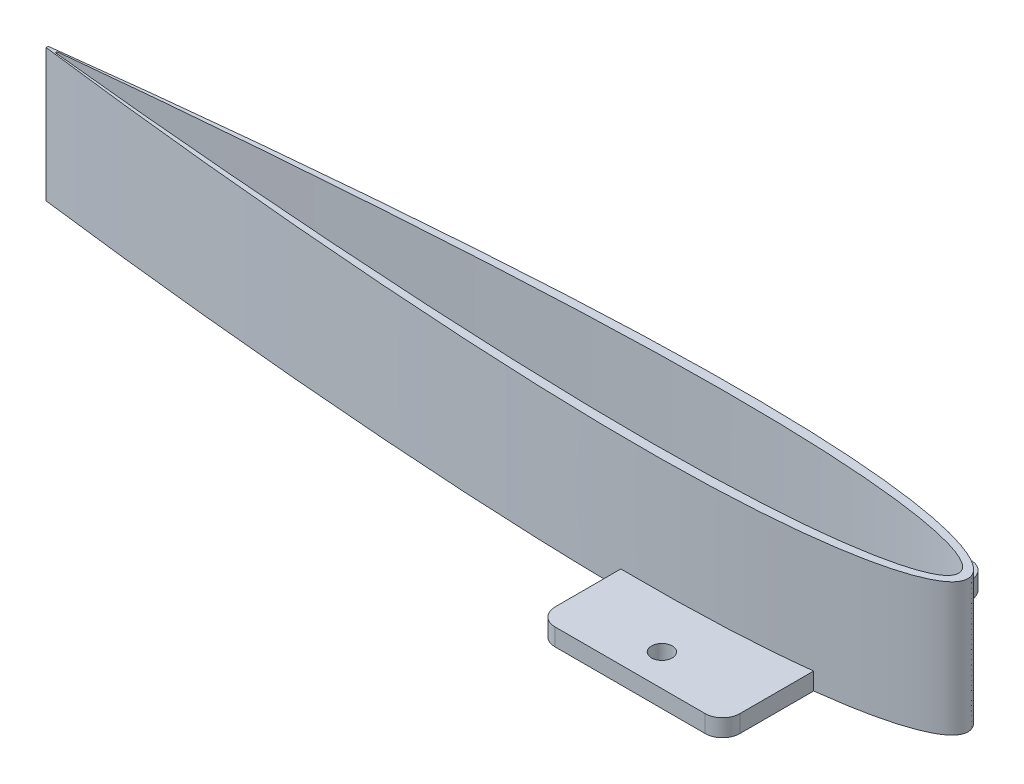
from build123d import *

# Parameters (mm, degrees)
BOSS_EXTRUDE1_DEPTH = 23
BOSS_EXTRUDE2_DEPTH = 3
CUT_EXTRUDE1_DEPTH  = 20
SKETCH4_R           = 1.8
CUT_EXTRUDE2_DEPTH  = 3


with BuildPart() as part:
    # Sketch1 → Boss-Extrude1 (new body)
    with BuildSketch(Plane(origin=(0, 0, 0), x_dir=(1, 0, 0), z_dir=(0, 1, 0))):
        with BuildLine():
            Line((-157.869, 0.181274205), (-157.869, -0.181274205))
            add(Edge.make_bspline(
                [(-157.869, 0.181274205), (-157.723403485, 0.199684926), (-157.142658378, 0.27312031), (-155.841955062, 0.436336132), (-153.689949438, 0.702894529), (-150.710182134, 1.064767751), (-146.935282047, 1.511699058), (-142.406585427, 2.031589686), (-137.173699622, 2.611192499), (-131.293955997, 3.236548664), (-124.831782054, 3.893294181), (-117.857991102, 4.566742449), (-110.449000996, 5.241792153), (-102.685990365, 5.902721731), (-94.654002783, 6.53297403), (-86.441009657, 7.115044129), (-78.136943231, 7.630574259), (-69.832711318, 8.060727481), (-61.619204695, 8.386862904), (-53.586307274, 8.591476899), (-45.821915366, 8.659319048), (-38.410975522, 8.578542481), (-31.434526786, 8.341736926), (-24.9687979, 7.946648949), (-19.084163696, 7.396579475), (-13.844510096, 6.699995358), (-9.304988726, 5.870590418), (-5.513605552, 4.923957812), (-2.498226595, 3.881769527), (-0.284248225, 2.747909514), (1.187201791, 1.521072632), (1.779058139, 0), (1.187201791, -1.521072632), (-0.284248225, -2.747909514), (-2.498226595, -3.881769527), (-5.513605552, -4.923957812), (-9.304988726, -5.870590418), (-13.844510096, -6.699995358), (-19.084163696, -7.396579475), (-24.9687979, -7.946648949), (-31.434526786, -8.341736926), (-38.410975522, -8.578542481), (-45.821915366, -8.659319048), (-53.586307274, -8.591476899), (-61.619204695, -8.386862904), (-69.832711318, -8.060727481), (-78.136943231, -7.630574259), (-86.441009657, -7.115044129), (-94.654002783, -6.53297403), (-102.685990365, -5.902721731), (-110.449000996, -5.241792153), (-117.857991102, -4.566742449), (-124.831782054, -3.893294181), (-131.293955997, -3.236548664), (-137.173699622, -2.611192499), (-142.406585427, -2.031589686), (-146.935282047, -1.511699058), (-150.710182134, -1.064767751), (-153.689949438, -0.702894529), (-155.841955062, -0.436336132), (-157.142658378, -0.27312031), (-157.723403485, -0.199684926), (-157.869, -0.181274205)],
                knots=[0, 0, 0, 0, 0.001358256, 0.005417715, 0.012132677, 0.021427702, 0.033198659, 0.047314098, 0.063616896, 0.081926116, 0.102039059, 0.123733469, 0.146769932, 0.170894438, 0.195841172, 0.221335499, 0.247097189, 0.272843817, 0.298294319, 0.323172601, 0.347211094, 0.370154165, 0.39176129, 0.41181002, 0.43009888, 0.446450615, 0.460716618, 0.472784432, 0.482593054, 0.490169979, 0.495736064, 0.5, 0.504263936, 0.509830021, 0.517406946, 0.527215568, 0.539283382, 0.553549385, 0.56990112, 0.58818998, 0.60823871, 0.629845835, 0.652788906, 0.676827399, 0.701705681, 0.727156183, 0.752902811, 0.778664501, 0.804158828, 0.829105562, 0.853230068, 0.876266531, 0.897960941, 0.918073884, 0.936383104, 0.952685902, 0.966801341, 0.978572298, 0.987867323, 0.994582285, 0.998641744, 1, 1, 1, 1], degree=3))
        make_face()
    extrude(amount=BOSS_EXTRUDE1_DEPTH)

    # Sketch2 → Boss-Extrude2 (add)
    with BuildSketch(Plane(origin=(0, 0, 0), x_dir=(1, 0, 0), z_dir=(0, 1, 0))):
        with BuildLine():
            Line((-46.9, -23), (-20.9, -23))
            ThreePointArc((-20.9, -23), (-18.778679656, -22.121320344), (-17.9, -20))
            Line((-17.9, -20), (-17.9, 20))
            ThreePointArc((-17.9, 20), (-18.778679656, 22.121320344), (-20.9, 23))
            Line((-20.9, 23), (-46.9, 23))
            ThreePointArc((-46.9, 23), (-49.021320344, 22.121320344), (-49.9, 20))
            Line((-49.9, 20), (-49.9, -20))
            ThreePointArc((-49.9, -20), (-49.021320344, -22.121320344), (-46.9, -23))
        make_face()
    extrude(amount=BOSS_EXTRUDE2_DEPTH)

    # Sketch3 → Cut-Extrude1 (cut)
    with BuildSketch(Plane(origin=(0, 23, 0), x_dir=(1, 0, 0), z_dir=(0, 1, 0))):
        with BuildLine():
            Line((-156.269, 0.147674205), (-156.269, -0.147674205))
            add(Edge.make_bspline(
                [(-156.269, 0.147674205), (-156.126324674, 0.162672461), (-155.557217694, 0.222497885), (-154.282577703, 0.355464773), (-152.173695683, 0.572621383), (-149.25365164, 0.867426534), (-145.554425881, 1.231523862), (-141.116532681, 1.65505633), (-135.988587734, 2.127231855), (-130.226773052, 2.63667887), (-123.894221597, 3.171696002), (-117.06032254, 3.720319142), (-109.799957344, 4.270246241), (-102.192674917, 4.808669712), (-94.321815716, 5.322100923), (-86.273595032, 5.796278851), (-78.136156293, 6.216247622), (-69.998605412, 6.566661356), (-61.950036814, 6.832334985), (-54.07856146, 6.999011569), (-46.470343565, 7.05427352), (-39.208658653, 6.988476831), (-32.372955807, 6.795608395), (-26.037997474, 6.473828853), (-20.272823955, 6.025963621), (-15.1403125, 5.458700103), (-10.69468594, 4.784299696), (-6.984476002, 4.013262029), (-4.036844712, 3.172086609), (-1.883328121, 2.24853683), (-0.448695997, 1.294392807), (0.1855032, 0), (-0.448695997, -1.294392807), (-1.883328121, -2.24853683), (-4.036844712, -3.172086609), (-6.984476002, -4.013262029), (-10.69468594, -4.784299696), (-15.1403125, -5.458700103), (-20.272823955, -6.025963621), (-26.037997474, -6.473828853), (-32.372955807, -6.795608395), (-39.208658653, -6.988476831), (-46.470343565, -7.05427352), (-54.07856146, -6.999011569), (-61.950036814, -6.832334985), (-69.998605412, -6.566661356), (-78.136156293, -6.216247622), (-86.273595032, -5.796278851), (-94.321815716, -5.322100923), (-102.192674917, -4.808669712), (-109.799957344, -4.270246241), (-117.06032254, -3.720319142), (-123.894221597, -3.171696002), (-130.226773052, -2.63667887), (-135.988587734, -2.127231855), (-141.116532681, -1.65505633), (-145.554425881, -1.231523862), (-149.25365164, -0.867426534), (-152.173695683, -0.572621383), (-154.282577703, -0.355464773), (-155.557217694, -0.222497885), (-156.126324674, -0.162672461), (-156.269, -0.147674205)],
                knots=[0, 0, 0, 0, 0.001360811, 0.005428038, 0.012156267, 0.021470482, 0.03326704, 0.047414968, 0.063757539, 0.082114088, 0.102282038, 0.12403911, 0.147145729, 0.171347612, 0.196378555, 0.221963406, 0.247821218, 0.273668571, 0.299222988, 0.324206394, 0.348348543, 0.371390297, 0.393086736, 0.413210068, 0.431552463, 0.44792908, 0.462181893, 0.474185722, 0.483860131, 0.491198837, 0.496361358, 0.5, 0.503638642, 0.508801163, 0.516139869, 0.525814278, 0.537818107, 0.55207092, 0.568447537, 0.586789932, 0.606913264, 0.628609703, 0.651651457, 0.675793606, 0.700777012, 0.726331429, 0.752178782, 0.778036594, 0.803621445, 0.828652388, 0.852854271, 0.87596089, 0.897717962, 0.917885912, 0.936242461, 0.952585032, 0.96673296, 0.978529518, 0.987843733, 0.994571962, 0.998639189, 1, 1, 1, 1], degree=3))
        make_face()
    extrude(amount=-CUT_EXTRUDE1_DEPTH, mode=Mode.SUBTRACT)

    # Sketch4 → Cut-Extrude2 (cut)
    with BuildSketch(Plane(origin=(0, 0, 0), x_dir=(1, 0, 0), z_dir=(0, 1, 0))):
        with Locations((-33.9, -17.5)):
            Circle(SKETCH4_R)
        with Locations((-33.9, 17.5)):
            Circle(SKETCH4_R)
    extrude(amount=CUT_EXTRUDE2_DEPTH, mode=Mode.SUBTRACT)


solid = part.part
